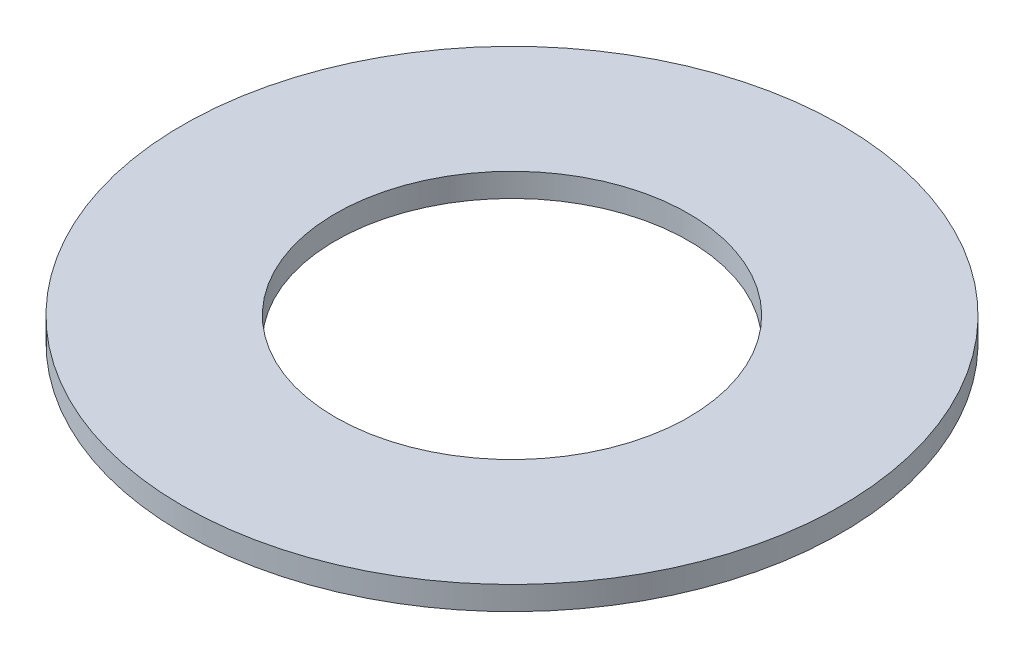
from build123d import *

# Parameters (mm, degrees)
SKETCH1_R           = 70
BOSS_EXTRUDE1_DEPTH = 5
SKETCH2_R           = 37.5
CUT_EXTRUDE1_DEPTH  = 100.121138008


with BuildPart() as part:
    # Sketch1 → Boss-Extrude1 (new body)
    with BuildSketch(Plane(origin=(0, 0, 0), x_dir=(1, 0, 0), z_dir=(0, 1, 0))):
        Circle(SKETCH1_R)
    extrude(amount=BOSS_EXTRUDE1_DEPTH)

    # Sketch2 → Cut-Extrude1 (cut, through all)
    with BuildSketch(Plane(origin=(0, 0, 0), x_dir=(1, 0, 0), z_dir=(0, 1, 0))):
        Circle(SKETCH2_R)
    extrude(amount=CUT_EXTRUDE1_DEPTH, mode=Mode.SUBTRACT)


solid = part.part
